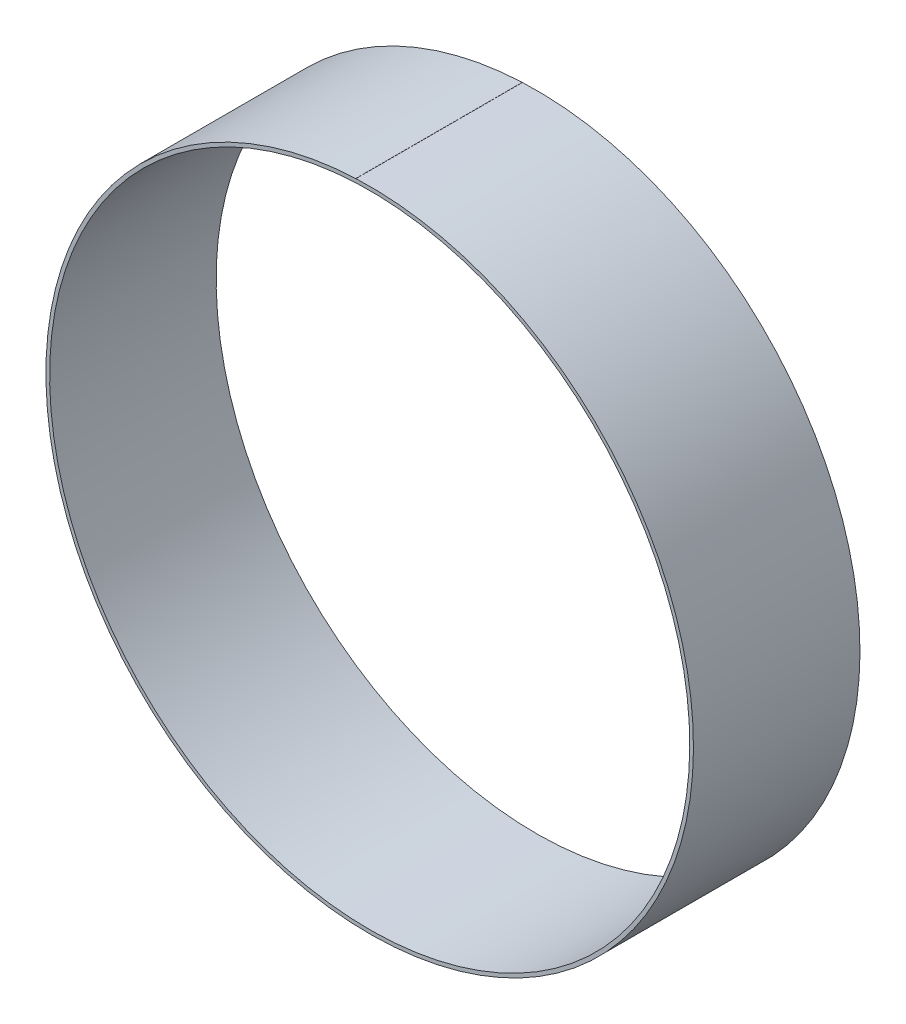
from build123d import *

# Parameters (mm, degrees)
BASE_FLANGE1_DEPTH      = 10
BASE_FLANGE1_DEPTH_BACK = 80


# Sheet-metal steps are written as plain solids
with BuildPart() as part:
    # Sketch1 → Base-Flange1 (new, two sides: drawn at the far end of the back side and taken through both)
    with BuildSketch(Plane.XY.offset(-BASE_FLANGE1_DEPTH_BACK)):
        with BuildLine():
            ThreePointArc((-7.453775566, 172.83935093), (7.403775876, -172.841499944), (-7.353775566, 172.843634493))
            Line((-7.353775566, 172.843634493), (-7.438790313, 174.8418268))
            ThreePointArc((-7.438790313, 174.8418268), (7.489368661, -174.839667573), (-7.539946382, 174.837493715))
            Line((-7.539946382, 174.837493715), (-7.453775566, 172.83935093))
        make_face()
    extrude(amount=BASE_FLANGE1_DEPTH + BASE_FLANGE1_DEPTH_BACK)


solid = part.part
